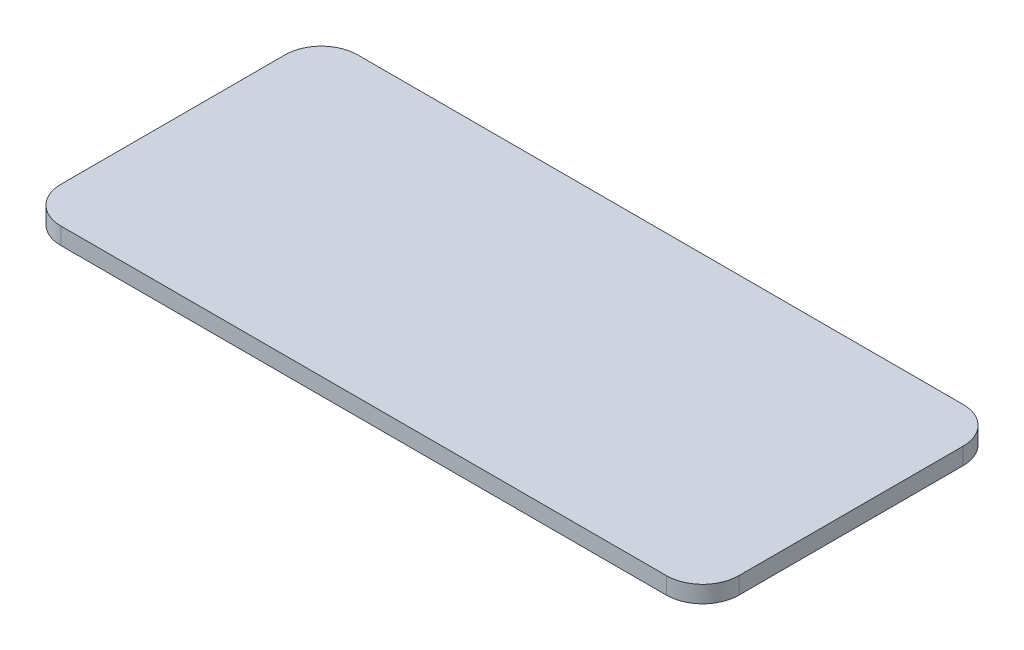
from build123d import *

# Parameters (mm, degrees)
SKETCH1_W           = 64
SKETCH1_H           = 28
BOSS_EXTRUDE1_DEPTH = 1.6
FILLET1_R           = 3.41


with BuildPart() as part:
    # Sketch1 → Boss-Extrude1 (new body)
    with BuildSketch(Plane(origin=(0, 0, 0), x_dir=(1, 0, 0), z_dir=(0, 1, 0))):
        Rectangle(SKETCH1_W, SKETCH1_H)
    extrude(amount=BOSS_EXTRUDE1_DEPTH)

    # Fillet1
    fillet1_edges = [part.edges().sort_by_distance(p)[0] for p in [
        (-32, 0.8, -14),
        (32, 0.8, -14),
        (-32, 0.8, 14),
        (32, 0.8, 14),
    ]]
    fillet(fillet1_edges, radius=FILLET1_R)


solid = part.part
